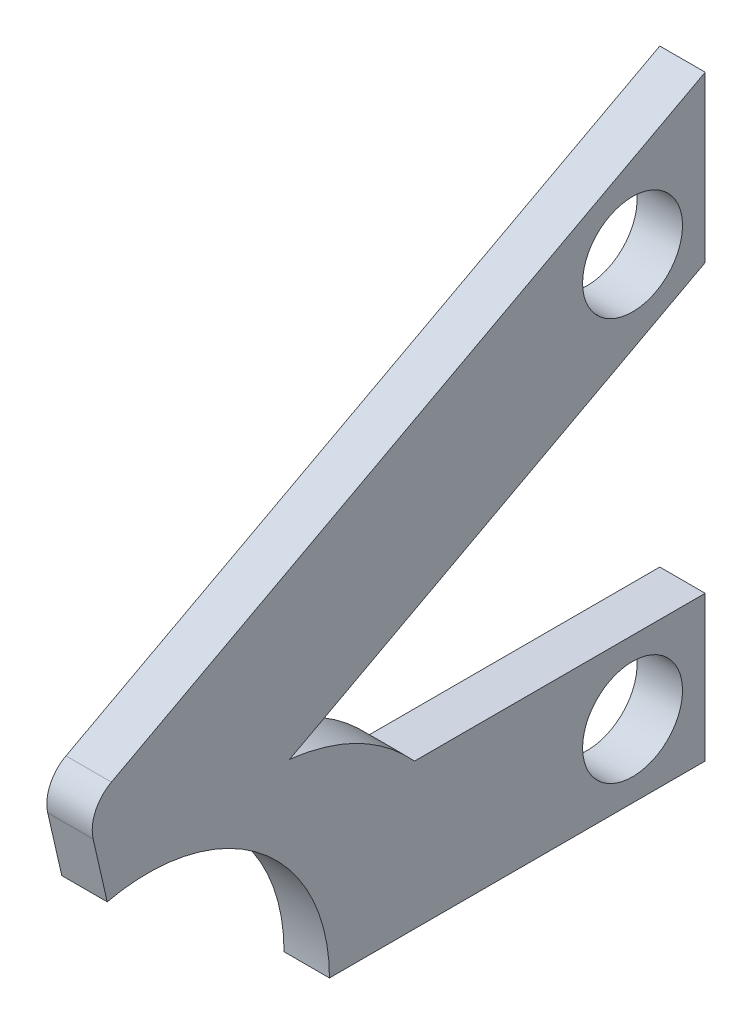
from build123d import *

# Parameters (mm, degrees)
BOSS_EXTRUDE1_DEPTH = 3.175
SKETCH7_R           = 3.4925
CUT_EXTRUDE3_DEPTH  = 678.24348403


with BuildPart() as part:
    # Sketch2 → Boss-Extrude1 (new body)
    with BuildSketch(Plane(origin=(-112.555, 0, -573.58969557), x_dir=(0, 0.6231241879767124, 0.7821229100073485), z_dir=(-1, 0, 0))):
        with BuildLine():
            Line((843.785187932, 138.582376841), (864.330586832, 122.213677187))
            ThreePointArc((864.330586832, 122.213677187), (874.263547789, 127), (884.196508746, 122.213677187))
            Line((884.196508746, 122.213677187), (887.645495372, 124.961515108))
            ThreePointArc((887.645495372, 124.961515108), (888.526447304, 126.330171585), (888.395706135, 127.952578317))
            Line((888.395706135, 127.952578317), (869.77401473, 171.202610873))
            Line((869.77401473, 171.202610873), (862.593047153, 162.189320479))
            Line((862.593047153, 162.189320479), (875.624929298, 131.921966414))
            add(Edge.make_bspline(
                [(866.008867214, 133.866862107), (871.18323177, 134.685144315), (875.624929298, 131.921966414)],
                knots=[0, 0, 0, 1, 1, 1], degree=2))
            Line((866.008867214, 133.866862107), (850.116129682, 146.528745607))
            Line((850.116129682, 146.528745607), (843.785187932, 138.582376841))
        make_face()
    extrude(amount=BOSS_EXTRUDE1_DEPTH)

    # Sketch7 → Cut-Extrude3 (cut, through all)
    with BuildSketch(Plane.ZY.offset(115.73)):
        with Locations((5.08, 639.251411908)):
            Circle(SKETCH7_R)
        with Locations((5.08, 667.397263635)):
            Circle(SKETCH7_R)
    extrude(amount=-CUT_EXTRUDE3_DEPTH, mode=Mode.SUBTRACT)


solid = part.part
